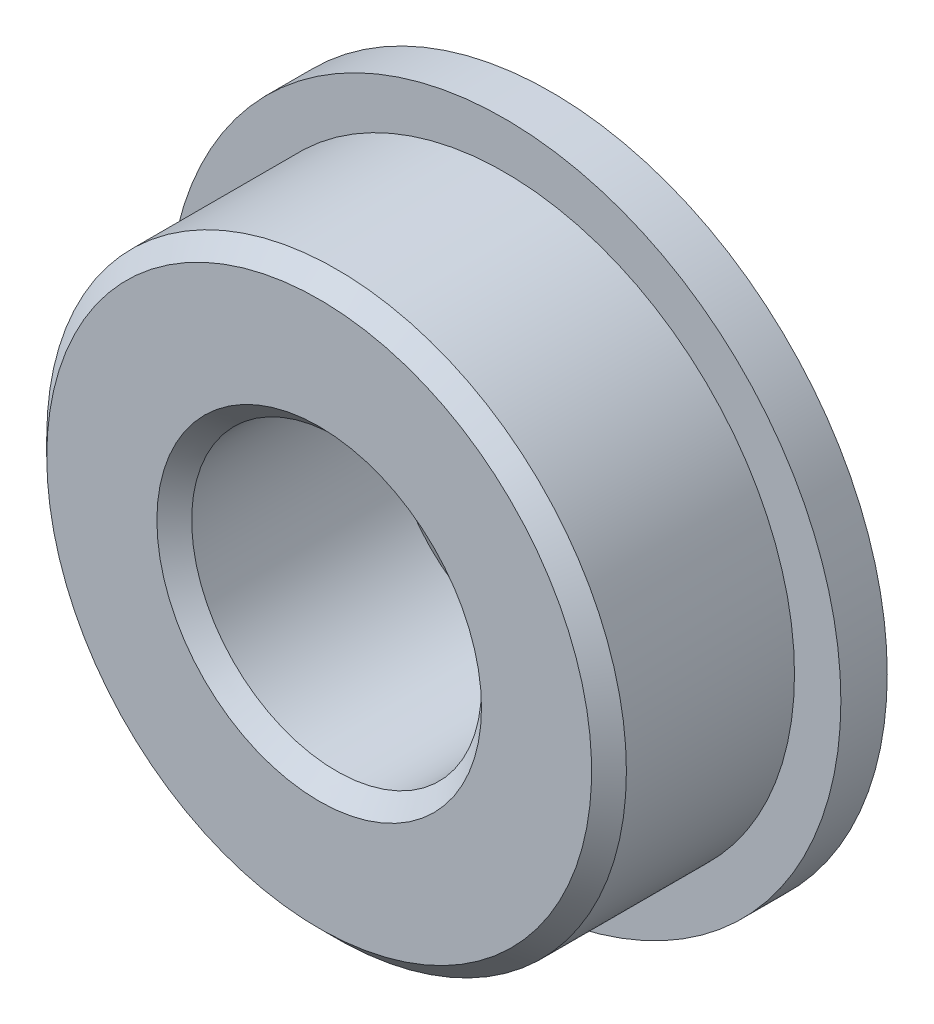
from build123d import *

# Parameters (mm, degrees)
CHAMFER1_SIZE = 0.3


with BuildPart() as part:
    # Sketch1 → Revolve1 (revolve)
    with BuildSketch(Plane(origin=(0, 0, 0), x_dir=(0, 0, -1), z_dir=(1, 0, 0))):
        Polygon((-2, 2.5), (2, 2.5), (2, 5.8), (1.2, 5.8), (1.2, 5), (-2, 5), align=None)
    revolve(axis=Axis((0, 0, 0), (0, 0, -1)))

    # Chamfer1
    chamfer1_edges = [part.edges().sort_by_distance(p)[0] for p in [
        (0, -2.5, -2),
        (0, -2.5, 2),
        (0, -5, 2),
    ]]
    chamfer(chamfer1_edges, length=CHAMFER1_SIZE)


solid = part.part
